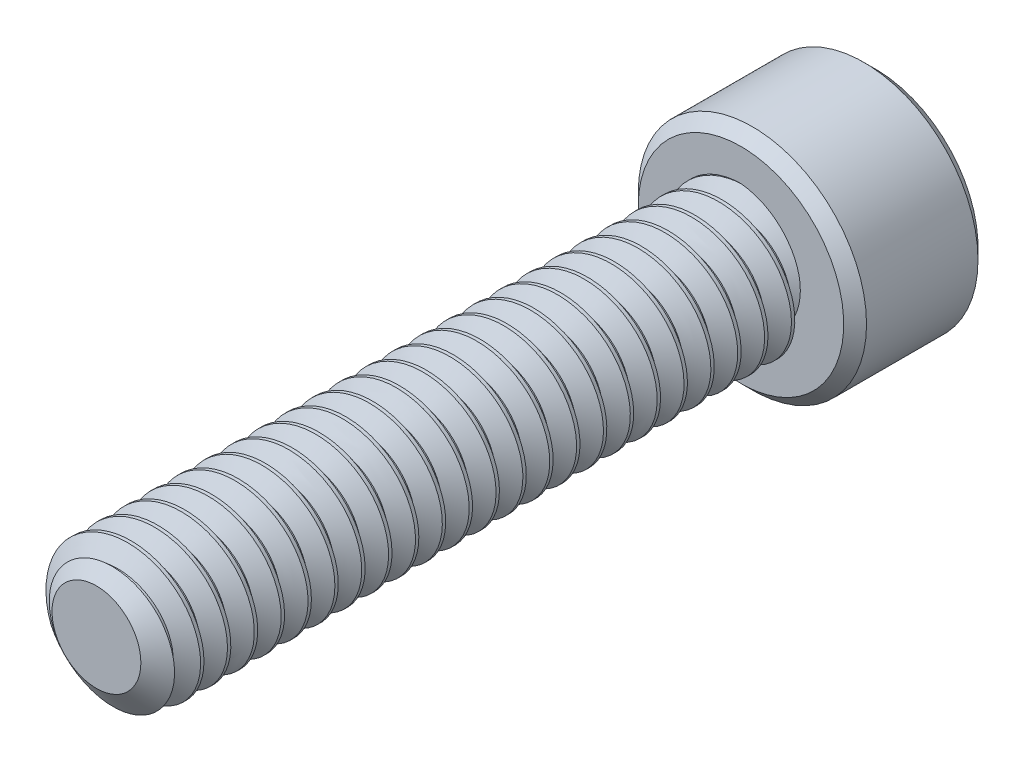
from build123d import *

# Parameters (mm, degrees)
SKETCH1_R          = 2.0828
EXTRUDE1_DEPTH     = 19.05
CUT_SWEEP1_PITCH   = 0.79375
SKETCH6_R          = 3.3734375
EXTRUDE2_DEPTH     = 3.96875
CUT_EXTRUDE1_DEPTH = 2.67890625
CHAMFER1_SIZE      = 0.33734375


with BuildPart() as part:
    # Sketch1 → Extrude1 (new body)
    with BuildSketch(Plane.XY):
        Circle(SKETCH1_R)
    extrude(amount=-EXTRUDE1_DEPTH)

    # Cut-Sweep1: the profile of Sketch3 profile screwed along a right-hand helix of 25 turns, 6 arcs to a turn; built about Z, then put on its axis
    cut_sweep1_z = Axis((0, 0, 0), (0, 0, 1))
    cut_sweep1_corners = [(2.0831, 0, -0.694704455), (1.567244252, 0, -0.396875), (1.567244252, 0, -0.29765625), (2.0831, 0, 0.000173205)]
    with BuildLine(mode=Mode.PRIVATE) as cut_sweep1_profile:
        Line(cut_sweep1_corners[0], cut_sweep1_corners[1])
        Line(cut_sweep1_corners[1], cut_sweep1_corners[2])
        Line(cut_sweep1_corners[2], cut_sweep1_corners[3])
        Line(cut_sweep1_corners[3], cut_sweep1_corners[0])
    cut_sweep1_cap = Face(cut_sweep1_profile.wire())
    cut_sweep1_turn_angles = [0, 30, 60, 90, 120, 150, 180, 210, 240, 270, 300, 330, 360]
    cut_sweep1_turn_weights = [1, 0.8660254037844387, 1, 0.8660254037844387, 1, 0.8660254037844387, 1, 0.8660254037844387, 1, 0.8660254037844387, 1, 0.8660254037844387, 1]
    cut_sweep1_turn_rails = [Edge.make_bspline([Vector(p[0], p[1], 0).rotate(cut_sweep1_z, cut_sweep1_turn_angles[k]) / cut_sweep1_turn_weights[k] + Vector(0, 0, p[2] + CUT_SWEEP1_PITCH * cut_sweep1_turn_angles[k] / 360) for k in range(13)], [0, 0, 0, 1, 1, 2, 2, 3, 3, 4, 4, 5, 5, 6, 6, 6], 2, cut_sweep1_turn_weights) for p in cut_sweep1_corners]
    cut_sweep1_turn_sides = [Face.make_surface_from_curves(cut_sweep1_turn_rails[p[0]], cut_sweep1_turn_rails[p[1]]) for p in [(0, 1), (1, 2), (2, 3), (3, 0)]]
    cut_sweep1 = Plane(origin=(0, 0, 0), x_dir=(0, 1, 0), z_dir=(0, 0, -1)) * Solid(Shell([*[p.moved(Location((0, 0, CUT_SWEEP1_PITCH * i))) for i in range(25) for p in cut_sweep1_turn_sides], cut_sweep1_cap, cut_sweep1_cap.rotate(cut_sweep1_z, 9000).moved(Location((0, 0, CUT_SWEEP1_PITCH * 9000 / 360)))]))
    add(cut_sweep1, mode=Mode.SUBTRACT)

    # Sketch4 → Cut-Revolve1 (revolve, cut)
    with BuildSketch(Plane(origin=(0, 0, 0), x_dir=(0, 0, -1), z_dir=(1, 0, 0)), mode=Mode.PRIVATE) as cut_revolve1_sk:
        Polygon((0.538848736, 2.0828), (0, 1.313244252), (0, 2.0828), align=None)
    revolve(cut_revolve1_sk.sketch.rotate(Axis((0, 0, 0), (0, 0, -1)), 261.048315518), axis=Axis((0, 0, 0), (0, 0, -1)), mode=Mode.SUBTRACT)

    # Sketch6 → Extrude2 (add)
    with BuildSketch(Plane(origin=(0, 0, -19.05), x_dir=(-1, 0, 0), z_dir=(0, 0, -1))):
        Circle(SKETCH6_R)
    extrude(amount=EXTRUDE2_DEPTH)

    # Sketch7 → Cut-Extrude1 (cut)
    with BuildSketch(Plane(origin=(0, 0, -23.01875), x_dir=(-1, 0, 0), z_dir=(0, 0, -1))):
        Polygon((0, 2.062222993), (-1.7859375, 1.031111496), (-1.7859375, -1.031111496), (0, -2.062222993), (1.7859375, -1.031111496), (1.7859375, 1.031111496), align=None)
    extrude(amount=-CUT_EXTRUDE1_DEPTH, mode=Mode.SUBTRACT)

    # Cut-Extrude2 cone 1 section (through the dimple's axis) → Cut-Extrude2 (revolve, cut)
    with BuildSketch(Plane(origin=(0, 0, -23.01875), x_dir=(0, 1, 0), z_dir=(1, 0, 0))):
        Polygon((0, 0), (2.062222993, 0), (0, 2.062222993), align=None)
    revolve(axis=Axis((0, 0, -23.01875), (0, 0, 1)), mode=Mode.SUBTRACT)

    # Chamfer1
    chamfer1_edges = [part.edges().sort_by_distance(p)[0] for p in [
        (3.3734375, 0, -19.05),
        (3.3734375, 0, -23.01875),
    ]]
    chamfer(chamfer1_edges, length=CHAMFER1_SIZE)


solid = part.part
